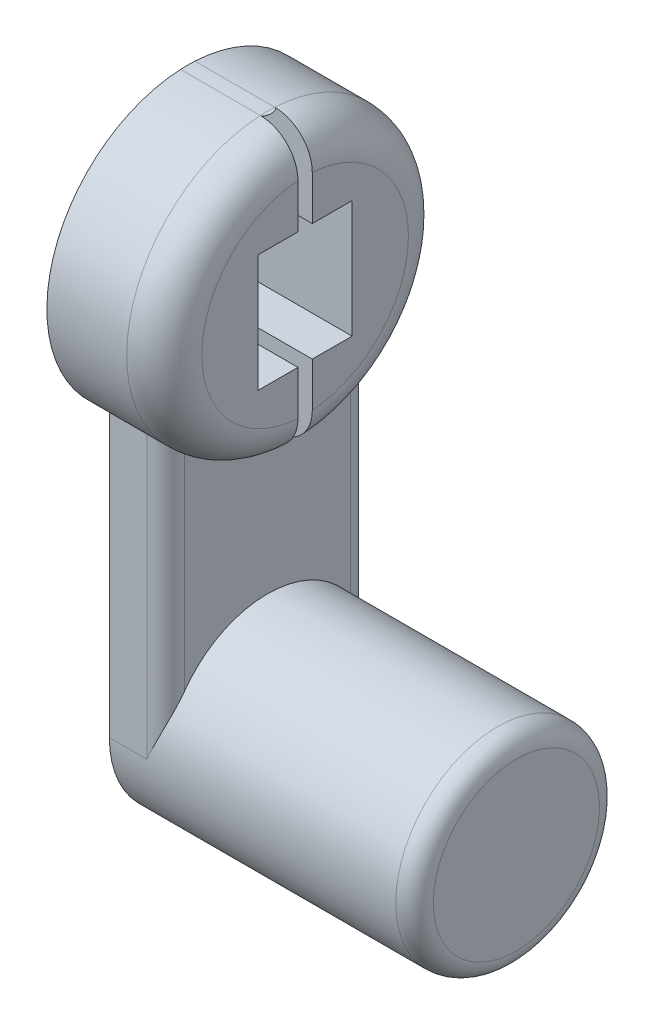
from build123d import *

# Parameters (mm, degrees)
SKETCH1_R            = 9.525
BOSS_EXTRUDE1_DEPTH  = 7.9375
FILLET1_R            = 2.54
SKETCH4_W            = 0.968946332
SKETCH4_H            = 19.025342126
CUT_EXTRUDE1_DEPTH   = 16.63506176
SKETCH6_W            = 6.35
SKETCH6_H            = 7.9375
CUT_EXTRUDE2_DEPTH   = 16.635061933
BOSS_EXTRUDE10_DEPTH = 5.3975
SKETCH11_R           = 6.887956427
BOSS_EXTRUDE12_DEPTH = 22.225
FILLET2_R            = 1.27
CUT_EXTRUDE3_START   = -1.5875
CUT_EXTRUDE3_DEPTH   = 1.5875
SKETCH13_W           = 8.382
SKETCH13_H           = 9.9695
SKETCH13_W_2         = 6.35
SKETCH13_H_2         = 7.9375
EXTRUDE_THIN1_DEPTH  = 1.27
SKETCH14_W           = 0.968946332
SKETCH14_H           = 9.9695
CUT_EXTRUDE4_DEPTH   = 37.77231348


with BuildPart() as part:
    # Sketch1 → Boss-Extrude1 (new body)
    with BuildSketch(Plane(origin=(0, 0, 0), x_dir=(0, 0, -1), z_dir=(1, 0, 0))):
        Circle(SKETCH1_R)
    extrude(amount=-BOSS_EXTRUDE1_DEPTH)

    # Fillet1
    fillet1_edges = [part.edges().sort_by_distance(p)[0] for p in [
        (0, 0, 9.525),
    ]]
    fillet(fillet1_edges, radius=FILLET1_R)

    # Sketch4 → Cut-Extrude1 (cut, through all)
    with BuildSketch(Plane(origin=(0, 0, 0), x_dir=(0, 0, -1), z_dir=(1, 0, 0))):
        Rectangle(SKETCH4_W, SKETCH4_H)
    extrude(amount=-CUT_EXTRUDE1_DEPTH, mode=Mode.SUBTRACT)

    # Sketch6 → Cut-Extrude2 (cut, through all)
    with BuildSketch(Plane(origin=(0, 0, 0), x_dir=(0, 0, -1), z_dir=(1, 0, 0))):
        Rectangle(SKETCH6_W, SKETCH6_H)
    extrude(amount=-CUT_EXTRUDE2_DEPTH, mode=Mode.SUBTRACT)

    # Sketch8 → Boss-Extrude10 (add)
    with BuildSketch(Plane(origin=(-2.54, 0, 0), x_dir=(0, 0, -1), z_dir=(1, 0, 0))):
        with BuildLine():
            Line((-6.887956427, -6.578881459), (-6.887956427, -25.628881459))
            Line((-6.887956427, -25.628881459), (6.887956427, -25.628881459))
            Line((6.887956427, -25.628881459), (6.887956427, -6.578881459))
            ThreePointArc((6.887956427, -6.578881459), (0, -9.512671063), (-6.887956427, -6.578881459))
        make_face()
    extrude(amount=-BOSS_EXTRUDE10_DEPTH)

    # Sketch11 → Boss-Extrude12 (add)
    with BuildSketch(Plane.ZY.offset(7.9375)):
        with Locations((0, -25.628881459)):
            Circle(SKETCH11_R)
    extrude(amount=-BOSS_EXTRUDE12_DEPTH)

    # Fillet2
    # the kernel refuses this fillet: 1.27 mm, written as the material it takes off along each edge
    with BuildSketch(Plane(origin=(14.2875, -25.628881459, 0), x_dir=(0, 0, 1), z_dir=(0, -1, 0))) as fillet2_piece_1:
        with BuildLine():
            CenterArc((6.887956427 - FILLET2_R, FILLET2_R), FILLET2_R, 270, 90)
            Line((6.887956427 - FILLET2_R, 0), (6.887956427, 0))
            Line((6.887956427, 0), (6.887956427, FILLET2_R))
        make_face()
    revolve(axis=Axis((14.2875, -25.628881459, 0), (-1, 0, 0)), mode=Mode.SUBTRACT)
    with BuildSketch(Plane(origin=(-2.54, -3.403881459, 6.887956427), x_dir=(-1, 0, 0), z_dir=(0, -1, 0))) as fillet2_piece_2_section:
        with BuildLine():
            CenterArc((FILLET2_R, FILLET2_R), FILLET2_R, 180, 90)
            Line((0, FILLET2_R), (0, 0))
            Line((0, 0), (FILLET2_R, 0))
        make_face()
    fillet2_piece_2 = extrude(amount=25.4, mode=Mode.PRIVATE)
    fillet2_piece_2 = fillet2_piece_2 - Plane(origin=(-2.832756395, 0, 0), x_dir=(0, 0, -1), z_dir=(1, 0, 0)) * Cylinder(9.525, 56, mode=Mode.PRIVATE)
    fillet2_piece_2 = fillet2_piece_2 - Plane(origin=(-2.832756395, -25.628881459, 0), x_dir=(0, 0, 1), z_dir=(-1, 0, 0)) * Cylinder(6.887956427, 56, mode=Mode.PRIVATE)
    add(fillet2_piece_2, mode=Mode.SUBTRACT)
    with BuildSketch(Plane(origin=(-2.54, -28.803881459, -6.887956427), x_dir=(-1, 0, 0), z_dir=(0, 1, 0))) as fillet2_piece_3_section:
        with BuildLine():
            CenterArc((FILLET2_R, FILLET2_R), FILLET2_R, 180, 90)
            Line((0, FILLET2_R), (0, 0))
            Line((0, 0), (FILLET2_R, 0))
        make_face()
    fillet2_piece_3 = extrude(amount=25.4, mode=Mode.PRIVATE)
    fillet2_piece_3 = fillet2_piece_3 - Plane(origin=(-2.83275673, 0, 0), x_dir=(0, 0, -1), z_dir=(1, 0, 0)) * Cylinder(9.525, 56, mode=Mode.PRIVATE)
    fillet2_piece_3 = fillet2_piece_3 - Plane(origin=(-2.83275673, -25.628881459, 0), x_dir=(0, 0, 1), z_dir=(-1, 0, 0)) * Cylinder(6.887956427, 56, mode=Mode.PRIVATE)
    add(fillet2_piece_3, mode=Mode.SUBTRACT)

    # Sketch12 → Cut-Extrude3 (cut)
    with BuildSketch(Plane.ZY.offset(7.9375).offset(CUT_EXTRUDE3_START)):
        with BuildLine():
            Line((-6.887956427, -25.628881459), (-6.887956427, -6.578881459))
            ThreePointArc((-6.887956427, -6.578881459), (0, -9.525), (6.887956427, -6.578881459))
            Line((6.887956427, -6.578881459), (6.887956427, -25.628881459))
            ThreePointArc((6.887956427, -25.628881459), (0, -32.516837887), (-6.887956427, -25.628881459))
        make_face()
    extrude(amount=CUT_EXTRUDE3_DEPTH, mode=Mode.SUBTRACT)

    # Sketch13 → Extrude-Thin1 (add)
    with BuildSketch(Plane.ZY.offset(7.9375)):
        Rectangle(SKETCH13_W, SKETCH13_H)
        Rectangle(SKETCH13_W_2, SKETCH13_H_2, mode=Mode.SUBTRACT)
    extrude(amount=EXTRUDE_THIN1_DEPTH)

    # Sketch14 → Cut-Extrude4 (cut, through all)
    with BuildSketch(Plane(origin=(0, 0, 0), x_dir=(0, 0, -1), z_dir=(1, 0, 0))):
        Rectangle(SKETCH14_W, SKETCH14_H)
    extrude(amount=-CUT_EXTRUDE4_DEPTH, mode=Mode.SUBTRACT)


solid = part.part
